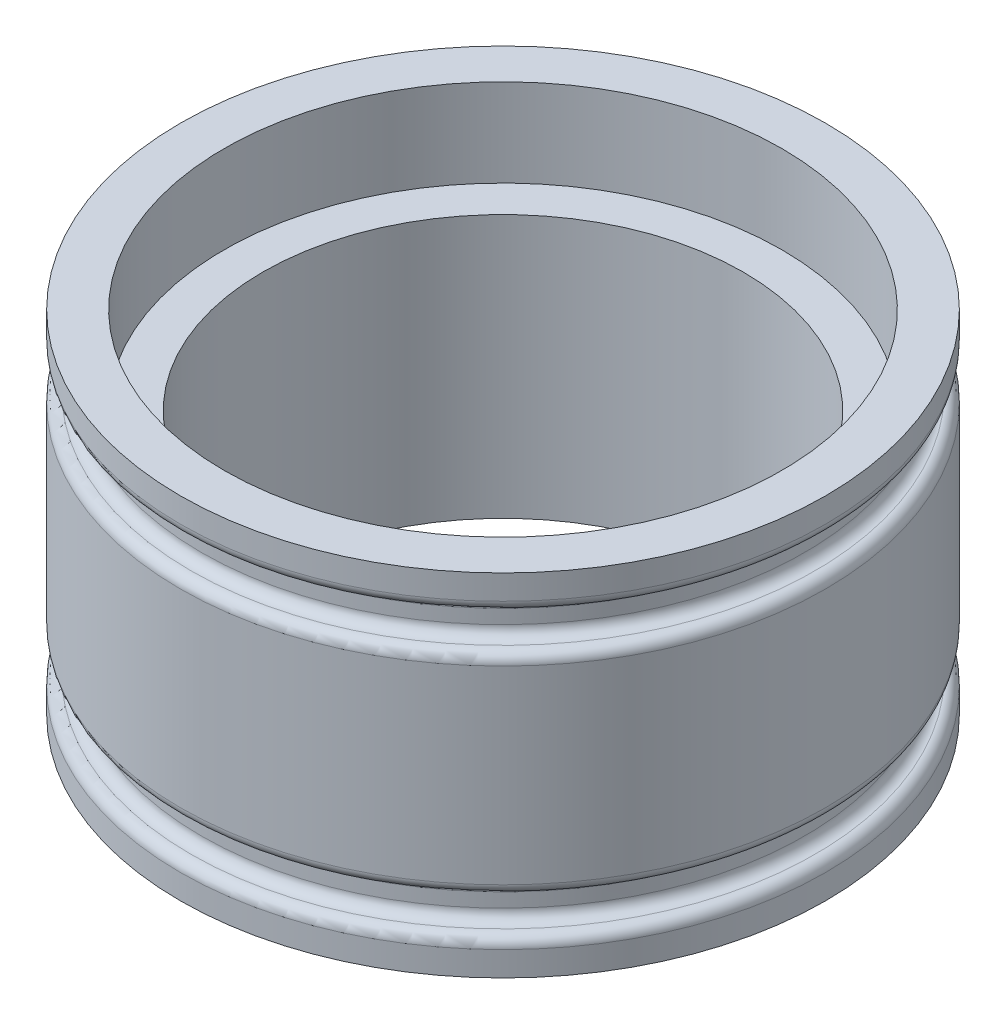
from build123d import *

# Parameters (mm, degrees)
SKETCH2_R           = 23.368
SKETCH2_R_2         = 20.193
BOSS_EXTRUDE1_DEPTH = 25.4
SKETCH3_R           = 20.193
SKETCH3_R_2         = 17.399
BOSS_EXTRUDE2_DEPTH = 19.05
SKETCH4_W           = 1.524
SKETCH4_H           = 2.54
FILLET1_R           = 0.762


with BuildPart() as part:
    # Sketch2 → Boss-Extrude1 (new body)
    with BuildSketch(Plane(origin=(0, 0, 0), x_dir=(1, 0, 0), z_dir=(0, 1, 0))):
        with Locations(Location((0, 0, 0), (0, 0, 270))):
            Circle(SKETCH2_R)
        with Locations(Location((0, 0, 0), (0, 0, 270))):
            Circle(SKETCH2_R_2, mode=Mode.SUBTRACT)
    extrude(amount=BOSS_EXTRUDE1_DEPTH)

    # Sketch3 → Boss-Extrude2 (add)
    with BuildSketch(Plane.XZ):
        with Locations(Location((0, 0, 0), (0, 0, 90))):
            Circle(SKETCH3_R)
        with Locations(Location((0, 0, 0), (0, 0, 270))):
            Circle(SKETCH3_R_2, mode=Mode.SUBTRACT)
    extrude(amount=-BOSS_EXTRUDE2_DEPTH)

    # Sketch4 → Cut-Revolve1 (revolve, cut)
    with BuildSketch(Plane.XY, mode=Mode.PRIVATE) as cut_revolve1_sk:
        with Locations((-22.606, 3.81)):
            Rectangle(SKETCH4_W, SKETCH4_H)
        with Locations((-22.606, 21.59)):
            Rectangle(SKETCH4_W, SKETCH4_H)
    revolve(cut_revolve1_sk.sketch.rotate(Axis((0, 0, 0), (0, -1, 0)), 270), axis=Axis((0, 0, 0), (0, -1, 0)), mode=Mode.SUBTRACT)

    # Fillet1
    fillet1_edges = [part.edges().sort_by_distance(p)[0] for p in [
        (0, 20.32, -21.844),
        (0, 22.86, -21.844),
        (0, 22.86, -23.368),
        (0, 20.32, -23.368),
        (0, 2.54, -23.368),
        (0, 2.54, -21.844),
        (0, 5.08, -21.844),
        (0, 5.08, -23.368),
    ]]
    fillet(fillet1_edges, radius=FILLET1_R - 0.0001)  # a hair under: the kernel refuses the full size


solid = part.part
